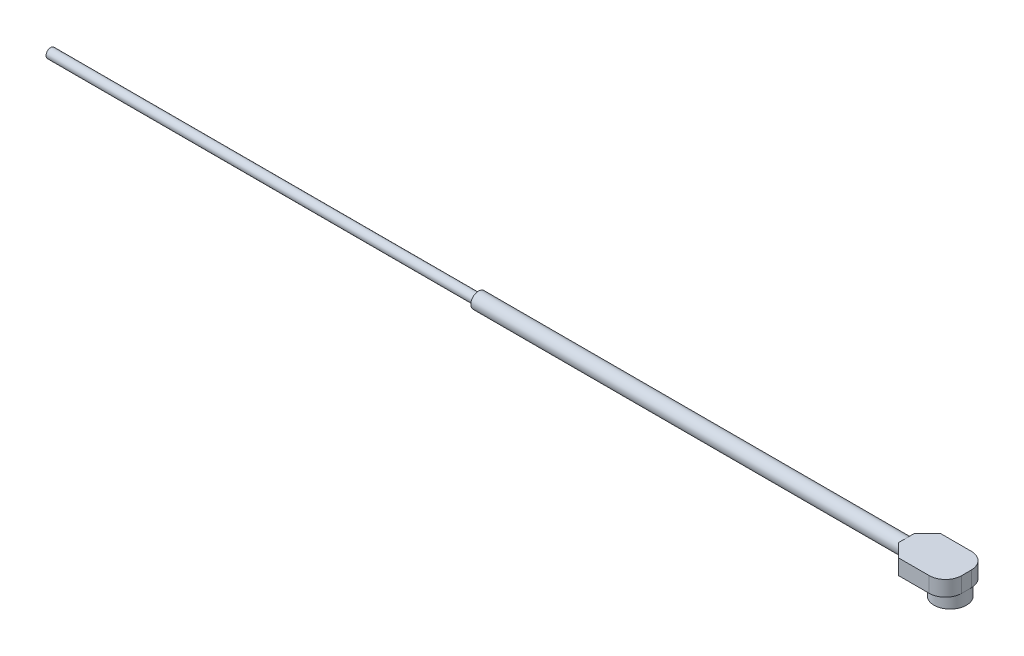
from build123d import *

# Parameters (mm, degrees)
SKETCH1_W           = 4.5
SKETCH1_H           = 3.15
BOSS_EXTRUDE1_DEPTH = 1.15
BOSS_EXTRUDE2_START = -1.15
SKETCH2_R           = 1.215
SKETCH2_R_2         = 1.05
SKETCH2_R_3         = 0.415
SKETCH2_R_4         = 0.25
BOSS_EXTRUDE2_DEPTH = 2.1
SKETCH3_R           = 0.575
BOSS_EXTRUDE3_DEPTH = 32
SKETCH4_R           = 0.35
BOSS_EXTRUDE4_DEPTH = 32
FILLET1_R           = 1.215
CHAMFER2_SIZE       = 1


with BuildPart() as part:
    # Sketch1 → Boss-Extrude1 (new body)
    with BuildSketch(Plane(origin=(0, 0, 0), x_dir=(1, 0, 0), z_dir=(0, 1, 0))):
        Rectangle(SKETCH1_W, SKETCH1_H)
    extrude(amount=BOSS_EXTRUDE1_DEPTH)

    # Sketch2 → Boss-Extrude2 (add)
    # profile 1 of 2: a face of its own
    with BuildSketch(Plane.XZ.offset(BOSS_EXTRUDE2_START)):
        with Locations((1.035, 0)):
            Circle(SKETCH2_R)
        with Locations(Location((1.035, 0, 0), (0, 0, 270))):
            Circle(SKETCH2_R_2, mode=Mode.SUBTRACT)
    # profile 2 of 2: a face of its own
    with BuildSketch(Plane.XZ.offset(BOSS_EXTRUDE2_START)):
        with Locations(Location((1.035, 0, 0), (0, 0, 270))):
            Circle(SKETCH2_R_3)
        with Locations(Location((1.035, 0, 0), (0, 0, 270))):
            Circle(SKETCH2_R_4, mode=Mode.SUBTRACT)
    extrude(amount=BOSS_EXTRUDE2_DEPTH)

    # Sketch3 → Boss-Extrude3 (add)
    with BuildSketch(Plane.ZY.offset(2.25)):
        with Locations(Location((0, 0.575, 0), (0, 0, 270))):
            Circle(SKETCH3_R)
    extrude(amount=BOSS_EXTRUDE3_DEPTH)

    # Sketch4 → Boss-Extrude4 (add)
    with BuildSketch(Plane.ZY.offset(34.25)):
        with Locations((0, 0.575)):
            Circle(SKETCH4_R)
    extrude(amount=BOSS_EXTRUDE4_DEPTH)

    # Fillet1
    fillet1_edges = [part.edges().sort_by_distance(p)[0] for p in [
        (2.25, 0.575, 1.575),
        (2.25, 0.575, -1.575),
    ]]
    fillet(fillet1_edges, radius=FILLET1_R)

    # Chamfer2
    chamfer2_edges = [part.edges().sort_by_distance(p)[0] for p in [
        (-2.25, 0.575, 1.575),
        (-2.25, 0.575, -1.575),
    ]]
    chamfer(chamfer2_edges, length=CHAMFER2_SIZE - 0.0001)  # a hair under: the kernel refuses the full size


solid = part.part
